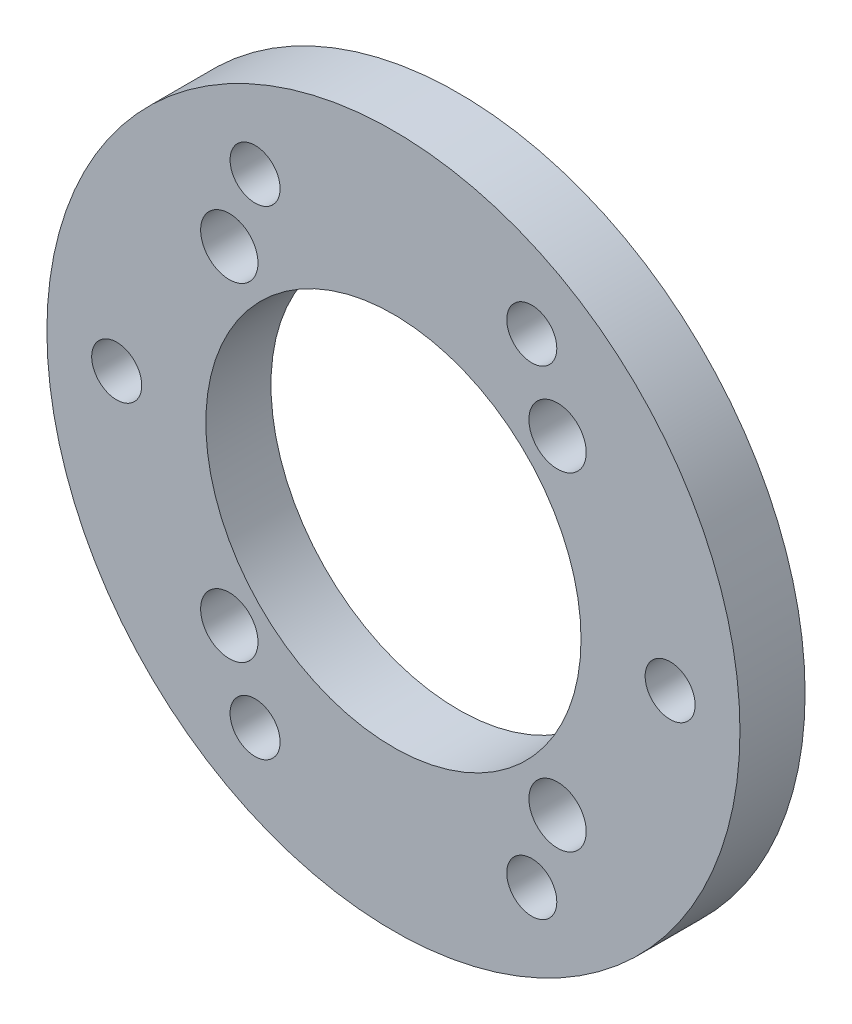
from build123d import *

# Parameters (mm, degrees)
SKETCH1_R                     = 16.891
BOSS_EXTRUDE1_DEPTH           = 3.175
F_2_CLEARANCE_HOLE1_D         = 2.4384
CIRPATTERN1_COUNT             = 6
F_3_CLEARANCE_HOLE1_OUTLINE_R = 1.397
F_3_CLEARANCE_HOLE1_DEPTH     = 3.175
SKETCH12_R                    = 9.144
CUT_EXTRUDE1_DEPTH            = 25.097559773


# Read off the part's stored shape, not the designer's step: #3 Clearance Hole1
with BuildPart() as part:
    # Sketch1 → Boss-Extrude1 (new body)
    with BuildSketch(Plane.XY):
        Circle(SKETCH1_R)
    extrude(amount=BOSS_EXTRUDE1_DEPTH)

    # #2 Clearance Hole1 (through all)
    with Locations(Plane.XY.offset(3.175)):
        with Locations((13.4874, 0)):
            f_2_clearance_hole1 = Hole(F_2_CLEARANCE_HOLE1_D / 2)

    # CirPattern1: #2 Clearance Hole1 ×6 about axis
    cirpattern1_axis = Axis((0, 0, 0), (0, 0, 1))
    for i in range(1, CIRPATTERN1_COUNT):
        add(f_2_clearance_hole1.rotate(cirpattern1_axis, i * 360 / CIRPATTERN1_COUNT), mode=Mode.SUBTRACT)

    # #3 Clearance Hole1 outline → #3 Clearance Hole1 (cut)
    with BuildSketch(Plane.XY):
        with Locations((-8, 8)):
            Circle(F_3_CLEARANCE_HOLE1_OUTLINE_R)
        with Locations((8, -8)):
            Circle(F_3_CLEARANCE_HOLE1_OUTLINE_R)
        with Locations((-8, -8)):
            Circle(F_3_CLEARANCE_HOLE1_OUTLINE_R)
        with Locations((8, 8)):
            Circle(F_3_CLEARANCE_HOLE1_OUTLINE_R)
    extrude(amount=F_3_CLEARANCE_HOLE1_DEPTH, mode=Mode.SUBTRACT)

    # Sketch12 → Cut-Extrude1 (cut, through all)
    with BuildSketch(Plane.XY.offset(3.175)):
        Circle(SKETCH12_R)
    extrude(amount=-CUT_EXTRUDE1_DEPTH, mode=Mode.SUBTRACT)


solid = part.part
